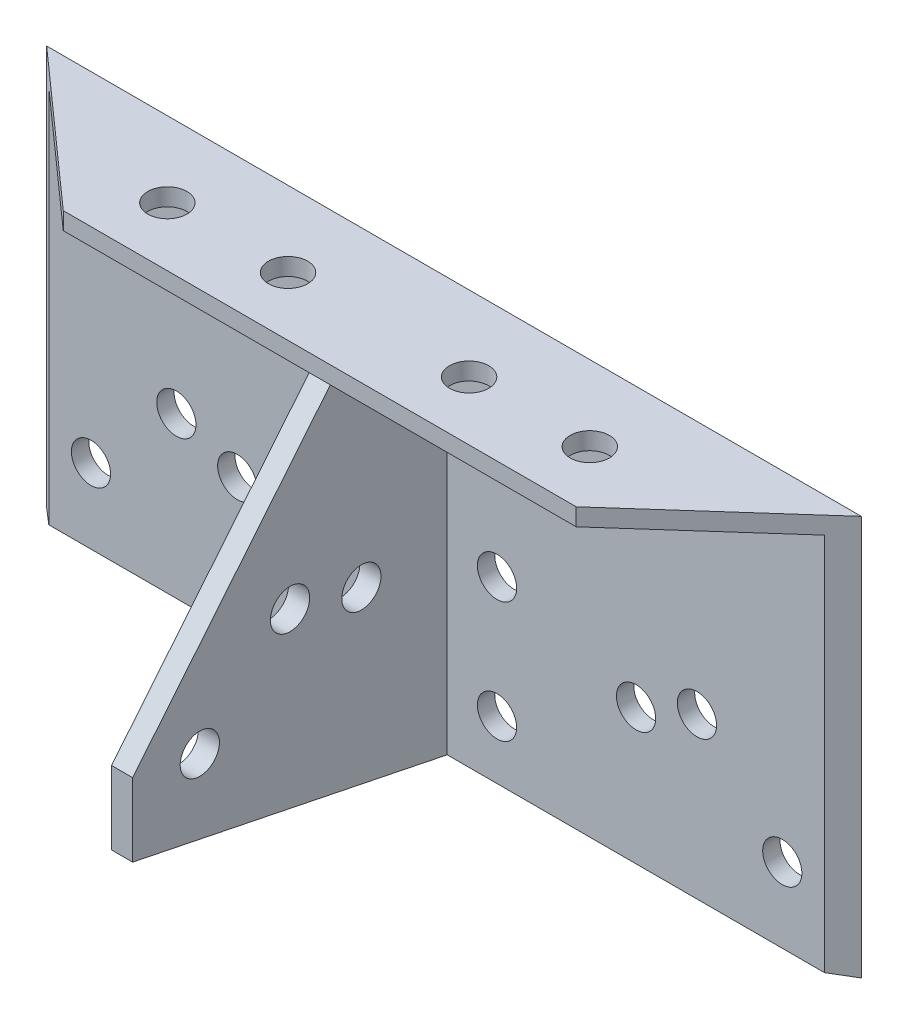
from build123d import *

# Parameters (mm, degrees)
SKETCH_1_W          = 540
SKETCH_1_H          = 265
SKETCH_1_R          = 13
EXTRUDE_548_DEPTH   = 11.5
SKETCH_2_W          = 540
SKETCH_2_H          = 11.5
EXTRUDE_1_DEPTH     = 77.5
CUT_EXTRUDE_1_DEPTH = 609.067430471
SKETCH_4_R          = 13
CUT_EXTRUDE_2_DEPTH = 609.067430471
SKETCH_5_W          = 14
SKETCH_5_H          = 253.5
EXTRUDE_2_DEPTH     = 208.5
SKETCH_6_R          = 13
CUT_EXTRUDE_3_DEPTH = 442.988687638
CUT_EXTRUDE_4_DEPTH = 442.988687638


with BuildPart() as part:
    # 草图1 → Extrude 548 (new body)
    with BuildSketch(Plane.XY):
        with Locations((270, 132.5)):
            Rectangle(SKETCH_1_W, SKETCH_1_H)
        with Locations((97.46594539, 108.46594539)):
            Circle(SKETCH_1_R, mode=Mode.SUBTRACT)
        with Locations((40.897402896, 51.897402896)):
            Circle(SKETCH_1_R, mode=Mode.SUBTRACT)
        with Locations((499.102597104, 51.897402896)):
            Circle(SKETCH_1_R, mode=Mode.SUBTRACT)
        with Locations((402.170987639, 92.261534081)):
            Circle(SKETCH_1_R, mode=Mode.SUBTRACT)
        with Locations((230, 121)):
            Circle(SKETCH_1_R, mode=Mode.SUBTRACT)
        with Locations((230, 41)):
            Circle(SKETCH_1_R, mode=Mode.SUBTRACT)
        with Locations((310, 41)):
            Circle(SKETCH_1_R, mode=Mode.SUBTRACT)
        with Locations((310, 121)):
            Circle(SKETCH_1_R, mode=Mode.SUBTRACT)
        with Locations((137.829012361, 92.261534081)):
            Circle(SKETCH_1_R, mode=Mode.SUBTRACT)
        with Locations((442.53405461, 108.46594539)):
            Circle(SKETCH_1_R, mode=Mode.SUBTRACT)
    extrude(amount=EXTRUDE_548_DEPTH)

    # 草图2 → 凸台-拉伸1 (add)
    with BuildSketch(Plane.XY.offset(11.5)):
        with Locations((270, 259.25)):
            Rectangle(SKETCH_2_W, SKETCH_2_H)
    extrude(amount=EXTRUDE_1_DEPTH)

    # 草图3 → 切除-拉伸1 (cut, through all)
    with BuildSketch(Plane(origin=(0, 265, 0), x_dir=(-1, 0, 0), z_dir=(0, 1, 0))):
        Polygon((0, 0), (-100, 89), (0, 89), align=None)
        Polygon((-540, 0), (-440, 89), (-540, 89), align=None)
    extrude(amount=-CUT_EXTRUDE_1_DEPTH, mode=Mode.SUBTRACT)

    # 草图4 → 切除-拉伸2 (cut, through all)
    with BuildSketch(Plane(origin=(0, 265, 0), x_dir=(-1, 0, 0), z_dir=(0, 1, 0))):
        with Locations((-210, 50)):
            Circle(SKETCH_4_R)
        with Locations((-130, 50)):
            Circle(SKETCH_4_R)
        with Locations((-410, 50)):
            Circle(SKETCH_4_R)
        with Locations((-330, 50)):
            Circle(SKETCH_4_R)
    extrude(amount=-CUT_EXTRUDE_2_DEPTH, mode=Mode.SUBTRACT)

    # 草图5 → 凸台-拉伸2 (add)
    with BuildSketch(Plane.XY.offset(11.5)):
        with Locations((270, 126.75)):
            Rectangle(SKETCH_5_W, SKETCH_5_H)
    extrude(amount=EXTRUDE_2_DEPTH)

    # 草图6 → 切除-拉伸3 (cut, through all)
    with BuildSketch(Plane(origin=(277, 0, 0), x_dir=(0, 0, -1), z_dir=(1, 0, 0))):
        with Locations((-115.693003517, 138.161774652)):
            Circle(SKETCH_6_R)
        with Locations((-175.485749012, 85.012667545)):
            Circle(SKETCH_6_R)
        with Locations((-68.400421337, 126.93798921)):
            Circle(SKETCH_6_R)
        Polygon((-89, 253.5), (-220, 93.5), (-220, 253.5), align=None)
        Polygon((-220, 45), (0, 0), (-220, 0), align=None)
    extrude(amount=-CUT_EXTRUDE_3_DEPTH, mode=Mode.SUBTRACT)

    # 草图7 → 切除-拉伸4 (cut, through all)
    with BuildSketch(Plane.ZY.offset(-277)):
        Polygon((0, 0), (11.5, 2.352272727), (11.5, 0), align=None)
    extrude(amount=-CUT_EXTRUDE_4_DEPTH, mode=Mode.SUBTRACT)


solid = part.part
